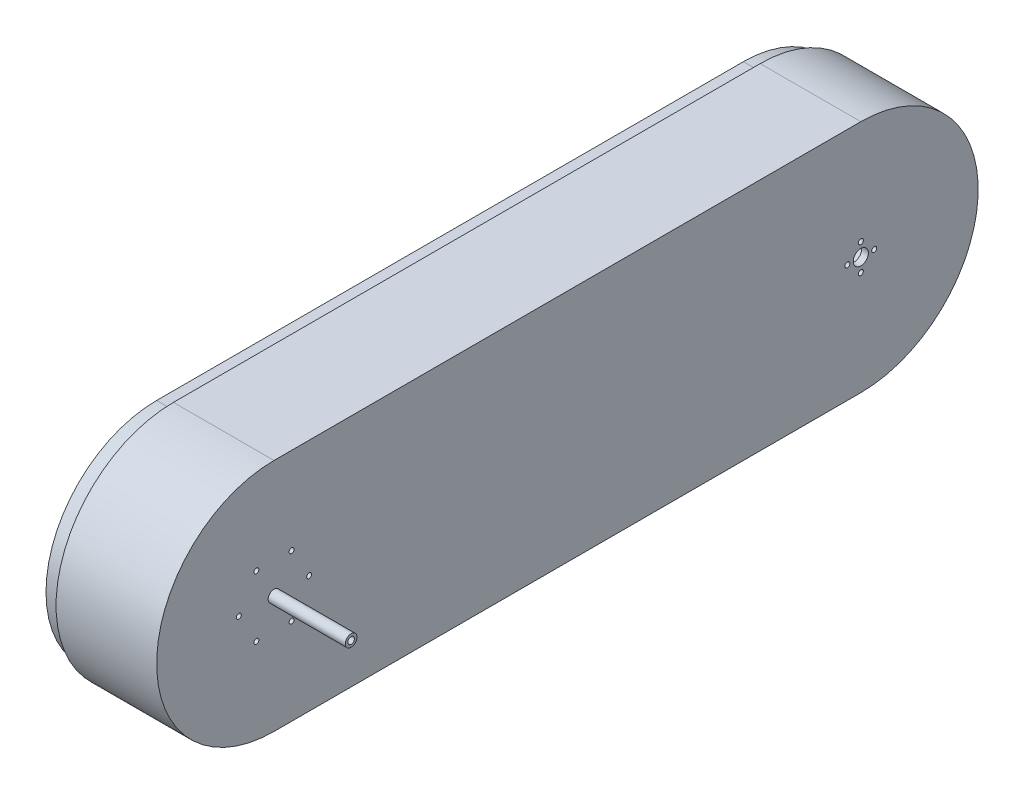
from build123d import *

# Parameters (mm, degrees)
BOSS_EXTRUDE1_DEPTH = 60
SHELL1_T            = -4
SKETCH4_R           = 1.5
CUT_EXTRUDE1_DEPTH  = 40
SKETCH6_R           = 4.5
CUT_EXTRUDE2_DEPTH  = 40
SKETCH7_R           = 1.5
CUT_EXTRUDE3_DEPTH  = 10
SKETCH8_R           = 3.5
BOSS_EXTRUDE2_DEPTH = 50
SKETCH9_W           = 3
SKETCH9_H           = 43.560021299
BOSS_EXTRUDE3_DEPTH = 50
SKETCH10_R          = 5
CUT_EXTRUDE4_DEPTH  = 30
BOSS_EXTRUDE4_DEPTH = 10
SKETCH13_R          = 2
CUT_EXTRUDE5_DEPTH  = 65
SKETCH17_W          = 10.421963941
SKETCH17_H          = 224.072224721
BOSS_EXTRUDE5_DEPTH = 9
SKETCH18_R          = 1.93755364
CUT_EXTRUDE6_DEPTH  = 239


with BuildPart() as part:
    # Sketch2 → Boss-Extrude1 (new body)
    with BuildSketch(Plane(origin=(0, 0, 0), x_dir=(0, 0, -1), z_dir=(1, 0, 0))):
        with BuildLine():
            Line((242.291021672, 93.859649123), (-107.708978328, 93.859649123))
            ThreePointArc((-107.708978328, 93.859649123), (-177.708978328, 23.859649123), (-107.708978328, -46.140350877))
            Line((-107.708978328, -46.140350877), (242.291021672, -46.140350877))
            ThreePointArc((242.291021672, -46.140350877), (312.291021672, 23.859649123), (242.291021672, 93.859649123))
        make_face()
    extrude(amount=BOSS_EXTRUDE1_DEPTH)

    # Shell1
    shell1_openings = [part.faces().sort_by_distance(p)[0] for p in [
        (0, 23.859649123, -67.291021672),
    ]]
    offset(amount=SHELL1_T, openings=shell1_openings, kind=Kind.INTERSECTION)

    # Sketch4 → Cut-Extrude1 (cut)
    with BuildSketch(Plane.ZY.offset(-56)):
        with Locations((-242.291021672, 31.859649123)):
            Circle(SKETCH4_R)
        with Locations((-250.291021672, 23.859649123)):
            Circle(SKETCH4_R)
        with Locations((-234.291021672, 23.859649123)):
            Circle(SKETCH4_R)
        with Locations((-242.291021672, 15.859649123)):
            Circle(SKETCH4_R)
    extrude(amount=-CUT_EXTRUDE1_DEPTH, mode=Mode.SUBTRACT)

    # Sketch6 → Cut-Extrude2 (cut)
    with BuildSketch(Plane.ZY.offset(-56)):
        with Locations((-242.291021672, 23.859649123)):
            Circle(SKETCH6_R)
    extrude(amount=-CUT_EXTRUDE2_DEPTH, mode=Mode.SUBTRACT)

    # Sketch7 → Cut-Extrude3 (cut)
    with BuildSketch(Plane.ZY.offset(-56)):
        with Locations((86.708978328, 23.859649123)):
            Circle(SKETCH7_R)
        with Locations((97.208978328, 42.046182602)):
            Circle(SKETCH7_R)
        with Locations((118.208978328, 42.046182602)):
            Circle(SKETCH7_R)
        with Locations((128.708978328, 23.859649123)):
            Circle(SKETCH7_R)
        with Locations((118.208978328, 5.673115643)):
            Circle(SKETCH7_R)
        with Locations((97.208978328, 5.673115643)):
            Circle(SKETCH7_R)
    extrude(amount=-CUT_EXTRUDE3_DEPTH, mode=Mode.SUBTRACT)

    # Sketch8 → Boss-Extrude2 (add)
    with BuildSketch(Plane.ZY.offset(-56)):
        with Locations((107.708978328, 23.859649123)):
            Circle(SKETCH8_R)
    extrude(amount=-BOSS_EXTRUDE2_DEPTH)

    # Sketch9 → Boss-Extrude3 (add)
    with BuildSketch(Plane.ZY.offset(-56)):
        with Locations((-153.791021672, -10.360340228)):
            Rectangle(SKETCH9_W, SKETCH9_H)
    extrude(amount=BOSS_EXTRUDE3_DEPTH)

    # Sketch10 → Cut-Extrude4 (cut)
    with BuildSketch(Plane.XY.offset(-152.291021672)):
        with Locations((31, -12.140350877)):
            Circle(SKETCH10_R)
    extrude(amount=-CUT_EXTRUDE4_DEPTH, mode=Mode.SUBTRACT)

    # Sketch13 → Cut-Extrude5 (cut)
    with BuildSketch(Plane(origin=(106, 0, 0), x_dir=(0, 0, -1), z_dir=(1, 0, 0))):
        with Locations((-107.708978328, 23.859649123)):
            Circle(SKETCH13_R)
    extrude(amount=-CUT_EXTRUDE5_DEPTH, mode=Mode.SUBTRACT)

    # Sketch17 → Boss-Extrude5 (add)
    with BuildSketch(Plane(origin=(0, -46.140350877, 0), x_dir=(-1, 0, 0), z_dir=(0, -1, 0))):
        with Locations((-28.624068245, 23.627411579)):
            Rectangle(SKETCH17_W, SKETCH17_H)
    extrude(amount=-BOSS_EXTRUDE5_DEPTH)

    # Sketch18 → Cut-Extrude6 (cut)
    with BuildSketch(Plane(origin=(0, 0, -135.66352394), x_dir=(-1, 0, 0), z_dir=(0, 0, -1))):
        with Locations((-28.566241777, -39.640350877)):
            Circle(SKETCH18_R)
    extrude(amount=-CUT_EXTRUDE6_DEPTH, mode=Mode.SUBTRACT)


with BuildPart() as body_2:
    # Sketch11 → Boss-Extrude4 (new body)
    with BuildSketch(Plane.ZY):
        with BuildLine():
            Line((107.708978328, 89.859649123), (-242.291021672, 89.859649123))
            ThreePointArc((-242.291021672, 89.859649123), (-308.291021672, 23.859649123), (-242.291021672, -42.140350877))
            Line((-242.291021672, -42.140350877), (107.708978328, -42.140350877))
            ThreePointArc((107.708978328, -42.140350877), (173.708978328, 23.859649123), (107.708978328, 89.859649123))
        make_face()
    extrude(amount=BOSS_EXTRUDE4_DEPTH)


solid = Compound([part.part, body_2.part])
